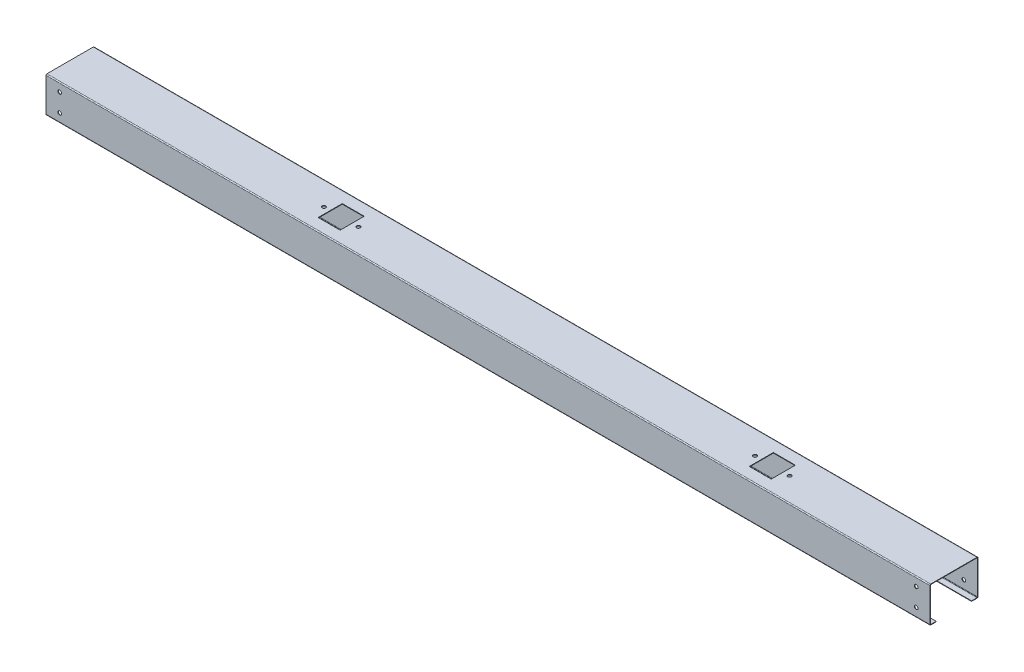
from build123d import *

# Parameters (mm, degrees)
SKETCH1_W                      = 1397
SKETCH1_H                      = 76.2
BASE_FLANGE1_DEPTH             = 0.75946
CUT_EXTRUDE1_DEPTH             = 10
SKETCH7_R                      = 2.8194
CUT_EXTRUDE2_DEPTH             = 10
EDGE_FLANGE1_STRIP_W           = 4.51104
EDGE_FLANGE1_STRIP_H           = 0.75946
EDGE_FLANGE1_STRIP_CUT_DEPTH   = 1397
EDGE_FLANGE1_STRIP_2_W         = 4.51104
EDGE_FLANGE1_STRIP_2_H         = 0.75946
EDGE_FLANGE1_STRIP_CUT_2_DEPTH = 1397
EDGE_FLANGE1_DEPTH             = 1397
EDGE_FLANGE1_BEND_DEPTH        = 1397
CUT_EXTRUDE5_DEPTH             = 705.822494238
CUT_EXTRUDE5_DEPTH_BACK        = 705.822494238
SKETCH44_R                     = 2.8194
EDGE_FLANGE2_STRIP_W           = 4.51104
EDGE_FLANGE2_STRIP_H           = 0.75946
EDGE_FLANGE2_STRIP_CUT_DEPTH   = 1397
EDGE_FLANGE2_STRIP_2_W         = 4.51104
EDGE_FLANGE2_STRIP_2_H         = 0.75946
EDGE_FLANGE2_STRIP_CUT_2_DEPTH = 1397
EDGE_FLANGE2_DEPTH             = 1397
EDGE_FLANGE2_BEND_DEPTH        = 1397
CUT_EXTRUDE6_REACH             = 703.787
SKETCH50_R                     = 1.651


# Sheet-metal steps are written as plain solids
with BuildPart() as part:
    # Sketch1 → Base-Flange1 (new body)
    with BuildSketch(Plane(origin=(0, 0, 0), x_dir=(1, 0, 0), z_dir=(0, 1, 0))):
        Rectangle(SKETCH1_W, SKETCH1_H)
    extrude(amount=-BASE_FLANGE1_DEPTH)

    # Sketch6 → Cut-Extrude1 (cut)
    with BuildSketch(Plane(origin=(0, 0, 0), x_dir=(1, 0, 0), z_dir=(0, 1, 0))):
        Polygon((-287.3375, -19.05), (-263.7165, -19.05), (-252.6665, -19.05), (-252.6665, 19.05), (-263.7165, 19.05), (-287.3375, 19.05), align=None)
        Polygon((394.1445, -19.05), (417.7655, -19.05), (428.8155, -19.05), (428.8155, 19.05), (417.7655, 19.05), (394.1445, 19.05), align=None)
    extrude(amount=-CUT_EXTRUDE1_DEPTH, mode=Mode.SUBTRACT)

    # Sketch7 → Cut-Extrude2 (cut)
    with BuildSketch(Plane(origin=(0, 0, 0), x_dir=(1, 0, 0), z_dir=(0, 1, 0))):
        with Locations(Location((-297.3375, 0, 0), (0, 0, 270))):
            Circle(SKETCH7_R)
        with Locations(Location((-242.6665, 0, 0), (0, 0, 270))):
            Circle(SKETCH7_R)
        with Locations(Location((384.1445, 0, 0), (0, 0, 270))):
            Circle(SKETCH7_R)
        with Locations(Location((438.8155, 0, 0), (0, 0, 270))):
            Circle(SKETCH7_R)
    extrude(amount=-CUT_EXTRUDE2_DEPTH, mode=Mode.SUBTRACT)

    # Edge-Flange1 strip (across the edge) → Edge-Flange1 strip cut (cut)
    with BuildSketch(Plane(origin=(-698.5, -0.75946, -38.1), x_dir=(0, 0, 1), z_dir=(1, 0, 0))):
        with Locations((-0.75946, -0.37973)):
            Rectangle(EDGE_FLANGE1_STRIP_W, EDGE_FLANGE1_STRIP_H)
    extrude(amount=EDGE_FLANGE1_STRIP_CUT_DEPTH, mode=Mode.SUBTRACT)

    # Edge-Flange1 strip 2 (across the edge) → Edge-Flange1 strip cut 2 (cut)
    with BuildSketch(Plane(origin=(698.5, -0.75946, 38.1), x_dir=(0, 0, -1), z_dir=(-1, 0, 0))):
        with Locations((-0.75946, -0.37973)):
            Rectangle(EDGE_FLANGE1_STRIP_2_W, EDGE_FLANGE1_STRIP_2_H)
    extrude(amount=EDGE_FLANGE1_STRIP_CUT_2_DEPTH, mode=Mode.SUBTRACT)

    # Edge-Flange1 section (across the edge) → Edge-Flange1 (add)
    with BuildSketch(Plane(origin=(-698.5, -0.75946, -38.1), x_dir=(0, 0, 1), z_dir=(1, 0, 0))):
        with BuildLine():
            Line((0, 0.7366), (0, 54.61254))
            Line((0, 54.61254), (0.75946, 54.61254))
            Line((0.75946, 54.61254), (0.75946, 0.7366))
            ThreePointArc((0.75946, 0.7366), (0.975205145, 0.215745145), (1.49606, 0))
            Line((1.49606, 0), (1.49606, -0.75946))
            ThreePointArc((1.49606, -0.75946), (0.438185829, -0.321274171), (0, 0.7366))
        make_face()
    extrude(amount=EDGE_FLANGE1_DEPTH)

    # Edge-Flange1 section 2 (across the edge) → Edge-Flange1 bend (add)
    with BuildSketch(Plane(origin=(698.5, -0.75946, 38.1), x_dir=(0, 0, -1), z_dir=(-1, 0, 0))):
        with BuildLine():
            Line((0, 0.7366), (0, 54.61254))
            Line((0, 54.61254), (0.75946, 54.61254))
            Line((0.75946, 54.61254), (0.75946, 0.7366))
            ThreePointArc((0.75946, 0.7366), (0.975205145, 0.215745145), (1.49606, 0))
            Line((1.49606, 0), (1.49606, -0.75946))
            ThreePointArc((1.49606, -0.75946), (0.438185829, -0.321274171), (0, 0.7366))
        make_face()
    extrude(amount=EDGE_FLANGE1_BEND_DEPTH)

    # Sketch44 → Cut-Extrude5 (cut, two sides: drawn at the far end of the back side and taken through both)
    with BuildSketch(Plane(origin=(0, 0, -38.1), x_dir=(-1, 0, 0), z_dir=(0, 0, -1)).offset(-CUT_EXTRUDE5_DEPTH_BACK)):
        with Locations(Location((-676.91, -13.45946, 0), (0, 0, 90))):
            Circle(SKETCH44_R)
        with Locations(Location((676.91, -13.45946, 0), (0, 0, 90))):
            Circle(SKETCH44_R)
        with Locations(Location((-676.91, -42.164, 0), (0, 0, 90))):
            Circle(SKETCH44_R)
        with Locations(Location((676.91, -42.164, 0), (0, 0, 90))):
            Circle(SKETCH44_R)
    extrude(amount=CUT_EXTRUDE5_DEPTH + CUT_EXTRUDE5_DEPTH_BACK, mode=Mode.SUBTRACT)

    # Edge-Flange2 strip (across the edge) → Edge-Flange2 strip cut (cut)
    with BuildSketch(Plane(origin=(698.5, -55.372, 37.34054), x_dir=(0, 1, 0), z_dir=(-1, 0, 0))):
        with Locations((-1.51892, -0.37973)):
            Rectangle(EDGE_FLANGE2_STRIP_W, EDGE_FLANGE2_STRIP_H)
    extrude(amount=EDGE_FLANGE2_STRIP_CUT_DEPTH, mode=Mode.SUBTRACT)

    # Edge-Flange2 strip 2 (across the edge) → Edge-Flange2 strip cut 2 (cut)
    with BuildSketch(Plane(origin=(-698.5, -55.372, -37.34054), x_dir=(0, 1, 0), z_dir=(1, 0, 0))):
        with Locations((-1.51892, -0.37973)):
            Rectangle(EDGE_FLANGE2_STRIP_2_W, EDGE_FLANGE2_STRIP_2_H)
    extrude(amount=EDGE_FLANGE2_STRIP_CUT_2_DEPTH, mode=Mode.SUBTRACT)

    # Edge-Flange2 section (across the edge) → Edge-Flange2 (add)
    with BuildSketch(Plane(origin=(698.5, -55.372, 37.34054), x_dir=(0, 1, 0), z_dir=(-1, 0, 0))):
        with BuildLine():
            Line((-0.75946, 0.7366), (-0.75946, 9.40054))
            Line((-0.75946, 9.40054), (0, 9.40054))
            Line((0, 9.40054), (0, 0.7366))
            ThreePointArc((0, 0.7366), (0.215745145, 0.215745145), (0.7366, 0))
            Line((0.7366, 0), (0.7366, -0.75946))
            ThreePointArc((0.7366, -0.75946), (-0.321274171, -0.321274171), (-0.75946, 0.7366))
        make_face()
    extrude(amount=EDGE_FLANGE2_DEPTH)

    # Edge-Flange2 section 2 (across the edge) → Edge-Flange2 bend (add)
    with BuildSketch(Plane(origin=(-698.5, -55.372, -37.34054), x_dir=(0, 1, 0), z_dir=(1, 0, 0))):
        with BuildLine():
            Line((-0.75946, 0.7366), (-0.75946, 9.40054))
            Line((-0.75946, 9.40054), (0, 9.40054))
            Line((0, 9.40054), (0, 0.7366))
            ThreePointArc((0, 0.7366), (0.215745145, 0.215745145), (0.7366, 0))
            Line((0.7366, 0), (0.7366, -0.75946))
            ThreePointArc((0.7366, -0.75946), (-0.321274171, -0.321274171), (-0.75946, 0.7366))
        make_face()
    extrude(amount=EDGE_FLANGE2_BEND_DEPTH)

    # Sketch50 → Cut-Extrude6 (cut, up to next)
    with BuildSketch(Plane.XZ.offset(56.13146), mode=Mode.PRIVATE) as cut_extrude6_sk1:
        with Locations(Location((623.57, 32.79394, 0), (0, 0, 270))):
            Circle(SKETCH50_R)
    cut_extrude6_tool1 = extrude(cut_extrude6_sk1.sketch, amount=-CUT_EXTRUDE6_REACH, mode=Mode.PRIVATE) & part.part
    # Sketch50 → Cut-Extrude6 (cut, up to next)
    with BuildSketch(Plane.XZ.offset(56.13146), mode=Mode.PRIVATE) as cut_extrude6_sk2:
        with Locations(Location((623.57, -32.79394, 0), (0, 0, 270))):
            Circle(SKETCH50_R)
    cut_extrude6_tool2 = extrude(cut_extrude6_sk2.sketch, amount=-CUT_EXTRUDE6_REACH, mode=Mode.PRIVATE) & part.part
    # Sketch50 → Cut-Extrude6 (cut, up to next)
    with BuildSketch(Plane.XZ.offset(56.13146), mode=Mode.PRIVATE) as cut_extrude6_sk3:
        with Locations(Location((127, -32.79394, 0), (0, 0, 270))):
            Circle(SKETCH50_R)
    cut_extrude6_tool3 = extrude(cut_extrude6_sk3.sketch, amount=-CUT_EXTRUDE6_REACH, mode=Mode.PRIVATE) & part.part
    # Sketch50 → Cut-Extrude6 (cut, up to next)
    with BuildSketch(Plane.XZ.offset(56.13146), mode=Mode.PRIVATE) as cut_extrude6_sk4:
        with Locations(Location((127, 32.79394, 0), (0, 0, 270))):
            Circle(SKETCH50_R)
    cut_extrude6_tool4 = extrude(cut_extrude6_sk4.sketch, amount=-CUT_EXTRUDE6_REACH, mode=Mode.PRIVATE) & part.part
    # Sketch50 → Cut-Extrude6 (cut, up to next)
    with BuildSketch(Plane.XZ.offset(56.13146), mode=Mode.PRIVATE) as cut_extrude6_sk5:
        with Locations(Location((-313.69, 32.79394, 0), (0, 0, 270))):
            Circle(SKETCH50_R)
    cut_extrude6_tool5 = extrude(cut_extrude6_sk5.sketch, amount=-CUT_EXTRUDE6_REACH, mode=Mode.PRIVATE) & part.part
    # Sketch50 → Cut-Extrude6 (cut, up to next)
    with BuildSketch(Plane.XZ.offset(56.13146), mode=Mode.PRIVATE) as cut_extrude6_sk6:
        with Locations(Location((-313.69, -32.79394, 0), (0, 0, 270))):
            Circle(SKETCH50_R)
    cut_extrude6_tool6 = extrude(cut_extrude6_sk6.sketch, amount=-CUT_EXTRUDE6_REACH, mode=Mode.PRIVATE) & part.part
    # Sketch50 → Cut-Extrude6 (cut, up to next)
    with BuildSketch(Plane.XZ.offset(56.13146), mode=Mode.PRIVATE) as cut_extrude6_sk7:
        with Locations(Location((-542.29, 32.79394, 0), (0, 0, 270))):
            Circle(SKETCH50_R)
    cut_extrude6_tool7 = extrude(cut_extrude6_sk7.sketch, amount=-CUT_EXTRUDE6_REACH, mode=Mode.PRIVATE) & part.part
    # Sketch50 → Cut-Extrude6 (cut, up to next)
    with BuildSketch(Plane.XZ.offset(56.13146), mode=Mode.PRIVATE) as cut_extrude6_sk8:
        with Locations(Location((-542.29, -32.79394, 0), (0, 0, 270))):
            Circle(SKETCH50_R)
    cut_extrude6_tool8 = extrude(cut_extrude6_sk8.sketch, amount=-CUT_EXTRUDE6_REACH, mode=Mode.PRIVATE) & part.part
    # Sketch50 → Cut-Extrude6 (cut, up to next)
    with BuildSketch(Plane.XZ.offset(56.13146), mode=Mode.PRIVATE) as cut_extrude6_sk9:
        with Locations(Location((-656.59, 32.79394, 0), (0, 0, 270))):
            Circle(SKETCH50_R)
    cut_extrude6_tool9 = extrude(cut_extrude6_sk9.sketch, amount=-CUT_EXTRUDE6_REACH, mode=Mode.PRIVATE) & part.part
    # Sketch50 → Cut-Extrude6 (cut, up to next)
    with BuildSketch(Plane.XZ.offset(56.13146), mode=Mode.PRIVATE) as cut_extrude6_sk10:
        with Locations(Location((-656.59, -32.79394, 0), (0, 0, 270))):
            Circle(SKETCH50_R)
    cut_extrude6_tool10 = extrude(cut_extrude6_sk10.sketch, amount=-CUT_EXTRUDE6_REACH, mode=Mode.PRIVATE) & part.part
    # Sketch50 → Cut-Extrude6 (cut, up to next)
    with BuildSketch(Plane.XZ.offset(56.13146), mode=Mode.PRIVATE) as cut_extrude6_sk11:
        with Locations(Location((318.77, 32.79394, 0), (0, 0, 270))):
            Circle(SKETCH50_R)
    cut_extrude6_tool11 = extrude(cut_extrude6_sk11.sketch, amount=-CUT_EXTRUDE6_REACH, mode=Mode.PRIVATE) & part.part
    # Sketch50 → Cut-Extrude6 (cut, up to next)
    with BuildSketch(Plane.XZ.offset(56.13146), mode=Mode.PRIVATE) as cut_extrude6_sk12:
        with Locations(Location((318.77, -32.79394, 0), (0, 0, 270))):
            Circle(SKETCH50_R)
    cut_extrude6_tool12 = extrude(cut_extrude6_sk12.sketch, amount=-CUT_EXTRUDE6_REACH, mode=Mode.PRIVATE) & part.part
    add(cut_extrude6_tool1.solids().sort_by_distance((623.57, -56.13146, 32.79394))[0], mode=Mode.SUBTRACT)
    add(cut_extrude6_tool2.solids().sort_by_distance((623.57, -56.13146, -32.79394))[0], mode=Mode.SUBTRACT)
    add(cut_extrude6_tool3.solids().sort_by_distance((127, -56.13146, -32.79394))[0], mode=Mode.SUBTRACT)
    add(cut_extrude6_tool4.solids().sort_by_distance((127, -56.13146, 32.79394))[0], mode=Mode.SUBTRACT)
    add(cut_extrude6_tool5.solids().sort_by_distance((-313.69, -56.13146, 32.79394))[0], mode=Mode.SUBTRACT)
    add(cut_extrude6_tool6.solids().sort_by_distance((-313.69, -56.13146, -32.79394))[0], mode=Mode.SUBTRACT)
    add(cut_extrude6_tool7.solids().sort_by_distance((-542.29, -56.13146, 32.79394))[0], mode=Mode.SUBTRACT)
    add(cut_extrude6_tool8.solids().sort_by_distance((-542.29, -56.13146, -32.79394))[0], mode=Mode.SUBTRACT)
    add(cut_extrude6_tool9.solids().sort_by_distance((-656.59, -56.13146, 32.79394))[0], mode=Mode.SUBTRACT)
    add(cut_extrude6_tool10.solids().sort_by_distance((-656.59, -56.13146, -32.79394))[0], mode=Mode.SUBTRACT)
    add(cut_extrude6_tool11.solids().sort_by_distance((318.77, -56.13146, 32.79394))[0], mode=Mode.SUBTRACT)
    add(cut_extrude6_tool12.solids().sort_by_distance((318.77, -56.13146, -32.79394))[0], mode=Mode.SUBTRACT)


solid = part.part
